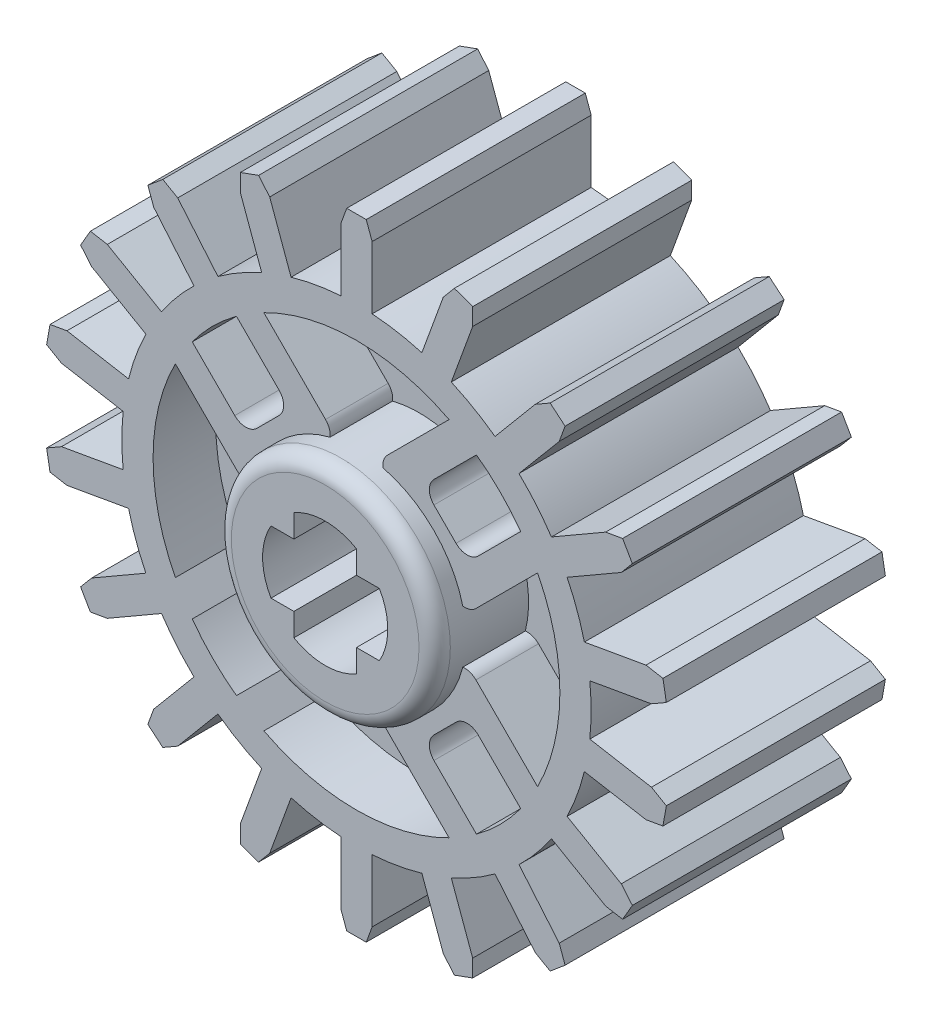
from build123d import *
from build123d.topology import SkipClean

# Parameters (mm, degrees)
SKETCH1_R                       = 7.5
SKETCH1_R_2                     = 2
BOSS_EXTRUDE1_DEPTH             = 3.5
SKETCH2_R                       = 6.5
CUT_EXTRUDE1_DEPTH              = 2
SKETCH5_R                       = 3.5
BOSS_EXTRUDE5_DEPTH             = 4.5
BOSS_EXTRUDE4_REACH             = 13.522
BOSS_EXTRUDE4_DIRECTION_2_REACH = 13.522
FILLET1_R                       = 0.5
CIRPATTERN1_START               = -3.5
CIRPATTERN1_DEPTH               = 7
BOSS_EXTRUDE6_DEPTH             = 7
CIRPATTERN2_COUNT               = 18
FILLET2_R                       = 0.5


with BuildPart() as part:
    # Sketch1 → Boss-Extrude1 (new, symmetric)
    # profile 1 of 5: a face of its own
    with BuildSketch(Plane.XY):
        Circle(SKETCH1_R)
        Circle(SKETCH1_R_2, mode=Mode.SUBTRACT)
    # profile 2 of 5: a face of its own
    with BuildSketch(Plane.XY):
        with BuildLine():
            Line((1, -1), (1, -1.732050808))
            ThreePointArc((1, -1.732050808), (1.414213562, -1.414213562), (1.732050808, -1))
            Line((1.732050808, -1), (1, -1))
        make_face()
    # profile 3 of 5: a face of its own
    with BuildSketch(Plane.XY):
        with BuildLine():
            ThreePointArc((-1.732050808, -1), (-1.414213562, -1.414213562), (-1, -1.732050808))
            Line((-1, -1.732050808), (-1, -1))
            Line((-1, -1), (-1.732050808, -1))
        make_face()
    # profile 4 of 5: a face of its own
    with BuildSketch(Plane.XY):
        with BuildLine():
            Line((-1.732050808, 1), (-1, 1))
            Line((-1, 1), (-1, 1.732050808))
            ThreePointArc((-1, 1.732050808), (-1.414213562, 1.414213562), (-1.732050808, 1))
        make_face()
    # profile 5 of 5: a face of its own
    with BuildSketch(Plane.XY):
        with BuildLine():
            Line((1, 1.732050808), (1, 1))
            Line((1, 1), (1.732050808, 1))
            ThreePointArc((1.732050808, 1), (1.414213562, 1.414213562), (1, 1.732050808))
        make_face()
    extrude(amount=BOSS_EXTRUDE1_DEPTH, both=True)

    # Sketch2 → Cut-Extrude1 (cut)
    with BuildSketch(Plane.XY.offset(3.5)):
        Circle(SKETCH2_R)
    cut_extrude1 = extrude(amount=-CUT_EXTRUDE1_DEPTH, mode=Mode.SUBTRACT)

    # Mirror1: Cut-Extrude1 across plane
    add(cut_extrude1.mirror(Plane.XY), mode=Mode.SUBTRACT)

    # Sketch5 → Boss-Extrude5 (add, symmetric)
    with SkipClean():  # the faces are left unmerged after this step: merging them gives an invalid solid
        with BuildSketch(Plane.XY):
            with Locations(Location((0, 0, 0), (0, 0, 180))):
                Circle(SKETCH5_R)
            with BuildLine():
                Line((-1.732050808, -1), (-1, -1))
                Line((-1, -1), (-1, -1.732050808))
                ThreePointArc((-1, -1.732050808), (0, -2), (1, -1.732050808))
                Line((1, -1.732050808), (1, -1))
                Line((1, -1), (1.732050808, -1))
                ThreePointArc((1.732050808, -1), (2, 0), (1.732050808, 1))
                Line((1.732050808, 1), (1, 1))
                Line((1, 1), (1, 1.732050808))
                ThreePointArc((1, 1.732050808), (0, 2), (-1, 1.732050808))
                Line((-1, 1.732050808), (-1, 1))
                Line((-1, 1), (-1.732050808, 1))
                ThreePointArc((-1.732050808, 1), (-2, 0), (-1.732050808, -1))
            make_face(mode=Mode.SUBTRACT)
        extrude(amount=BOSS_EXTRUDE5_DEPTH, both=True)

    # Boss-Extrude4: up to this face of the body (flat: up to its plane)
    boss_extrude4_end = Plane(part.part.faces().sort_by_distance((-7.287867966, 0, 3.5))[0])
    # Sketch3 → Boss-Extrude4 (add, up to the picked face)
    with BuildSketch(Plane.XY, mode=Mode.PRIVATE) as boss_extrude4_sk1:
        with BuildLine():
            ThreePointArc((3.83436875, 5.248582312), (3.407353004, 5.535336079), (2.959000359, 5.787427484))
            Line((2.959000359, 5.787427484), (0.707106781, 3.535533906))
            Line((0.707106781, 3.535533906), (3.535533906, 0.707106781))
            Line((3.535533906, 0.707106781), (5.787427484, 2.959000359))
            ThreePointArc((5.787427484, 2.959000359), (5.535336079, 3.407353004), (5.248582312, 3.83436875))
            Line((5.248582312, 3.83436875), (4.531371416, 3.117157854))
            Line((4.531371416, 3.117157854), (3.535533906, 2.121320344))
            Line((3.535533906, 2.121320344), (2.121320344, 3.535533906))
            Line((2.121320344, 3.535533906), (3.117157854, 4.531371416))
            Line((3.117157854, 4.531371416), (3.83436875, 5.248582312))
        make_face()
    boss_extrude4_tool1 = split(extrude(boss_extrude4_sk1.sketch, amount=BOSS_EXTRUDE4_REACH, mode=Mode.PRIVATE), bisect_by=boss_extrude4_end, keep=Keep.BOTH, mode=Mode.PRIVATE)
    add(boss_extrude4_tool1.solids().sort_by(Axis((1.883857, 4.610677, 0), (0, 0, 1)))[0])

    # Boss-Extrude4 direction 2: up to this face of the body (flat: up to its plane)
    boss_extrude4_direction_2_end = Plane(part.part.faces().sort_by_distance((-7.287867966, 0, -3.5))[0])
    # Sketch3 → Boss-Extrude4 direction 2 (add, up to the picked face)
    with BuildSketch(Plane.XY, mode=Mode.PRIVATE) as boss_extrude4_direction_2_sk1:
        with BuildLine():
            ThreePointArc((3.83436875, 5.248582312), (3.407353004, 5.535336079), (2.959000359, 5.787427484))
            Line((2.959000359, 5.787427484), (0.707106781, 3.535533906))
            Line((0.707106781, 3.535533906), (3.535533906, 0.707106781))
            Line((3.535533906, 0.707106781), (5.787427484, 2.959000359))
            ThreePointArc((5.787427484, 2.959000359), (5.535336079, 3.407353004), (5.248582312, 3.83436875))
            Line((5.248582312, 3.83436875), (4.531371416, 3.117157854))
            Line((4.531371416, 3.117157854), (3.535533906, 2.121320344))
            Line((3.535533906, 2.121320344), (2.121320344, 3.535533906))
            Line((2.121320344, 3.535533906), (3.117157854, 4.531371416))
            Line((3.117157854, 4.531371416), (3.83436875, 5.248582312))
        make_face()
    boss_extrude4_direction_2_tool1 = split(extrude(boss_extrude4_direction_2_sk1.sketch, amount=-BOSS_EXTRUDE4_DIRECTION_2_REACH, mode=Mode.PRIVATE), bisect_by=boss_extrude4_direction_2_end, keep=Keep.BOTH, mode=Mode.PRIVATE)
    add(boss_extrude4_direction_2_tool1.solids().sort_by(Axis((1.883857, 4.610677, 0), (0, 0, -1)))[0])

    # Fillet1
    # the kernel refuses this fillet: 0.5 mm, written as the material it adds along each edge
    with BuildSketch(Plane(origin=(2.121320344, 3.535533906, 0.25), x_dir=(0.7071067811865485, 0.7071067811865467, 0), z_dir=(0, 0, 1)), Plane(origin=(3.535533906, 2.121320344, 0.25), x_dir=(-0.7071067811865476, 0.7071067811865476, 0), z_dir=(0, 0, 1)), Plane(origin=(3.535533906, 2.121320344, -0.25), x_dir=(0.7071067811865471, 0.707106781186548, 0), z_dir=(0, 0, -1)), Plane(origin=(2.121320344, 3.535533906, -0.25), x_dir=(0.7071067811865476, -0.7071067811865476, 0), z_dir=(0, 0, -1))) as fillet1_piece_1:
        with BuildLine():
            CenterArc((FILLET1_R, -FILLET1_R), FILLET1_R, 90, 90)
            Line((0, -FILLET1_R), (0, 0))
            Line((0, 0), (FILLET1_R, 0))
        make_face()
    extrude(amount=3.25)
    # the kernel refuses this fillet: 0.5 mm, written as the material it takes off along each edge
    with BuildSketch(Plane(origin=(0.707106781, 3.535533906, 1.5), x_dir=(0.7071067812115436, -0.7071067811615515, 0), z_dir=(0, 0, 1))) as fillet1_2_piece_1:
        with BuildLine():
            CenterArc((0.5, 0.397903145), FILLET1_R, 179.999999998, 52.731478319)
            Line((0, 0.397903146), (0, 0))
            Line((0, 0), (0.197224362, 0))
        make_face()
    extrude(amount=2.994757864, mode=Mode.SUBTRACT)
    with BuildSketch(Plane(origin=(3.535533906, 0.707106781, 1.5), x_dir=(0.7071067811865472, 0.7071067811865478, 0), z_dir=(0, 0, 1)), Plane(origin=(0.707106781, 3.535533906, -1.5), x_dir=(0.7071067811865481, 0.707106781186547, 0), z_dir=(0, 0, -1))) as fillet1_2_piece_2:
        with BuildLine():
            CenterArc((0.397903146, 0.5), FILLET1_R, 217.268521681, 52.731478319)
            Line((0, 0.197224362), (0, 0))
            Line((0, 0), (0.397903146, 0))
        make_face()
    extrude(amount=2.994757864, mode=Mode.SUBTRACT)
    with BuildSketch(Plane(origin=(3.535533906, 0.707106781, -1.5), x_dir=(0.7071067811865472, 0.7071067811865478, 0), z_dir=(0, 0, -1))) as fillet1_2_piece_3:
        with BuildLine():
            CenterArc((0.397903146, -0.5), FILLET1_R, 90, 52.731478319)
            Line((0, -0.197224362), (0, 0))
            Line((0, 0), (0.397903146, 0))
        make_face()
    extrude(amount=2.994757864, mode=Mode.SUBTRACT)

    # CirPattern1: read off the stored shape, not the designer's step
    # CirPattern1 outline → CirPattern1 (add)
    with BuildSketch(Plane.XY.offset(CIRPATTERN1_START)):
        with BuildLine():
            Line((-3.816893918, -0.988466794), (-5.787427484, -2.959000359))
            ThreePointArc((-5.787427484, -2.959000359), (-5.535336079, -3.407353004), (-5.248582313, -3.83436875))
            Line((-5.248582313, -3.83436875), (-3.889087297, -2.474873734))
            ThreePointArc((-3.889087297, -2.474873734), (-3.535533906, -2.328427125), (-3.181980515, -2.474873734))
            Line((-3.181980515, -2.474873734), (-2.474873734, -3.181980515))
            ThreePointArc((-2.474873734, -3.181980515), (-2.328427125, -3.535533906), (-2.474873734, -3.889087297))
            Line((-2.474873734, -3.889087297), (-3.83436875, -5.248582313))
            ThreePointArc((-3.83436875, -5.248582313), (-3.407353004, -5.535336079), (-2.959000359, -5.787427484))
            Line((-2.959000359, -5.787427484), (-0.988466794, -3.816893918))
            ThreePointArc((-0.988466794, -3.816893918), (-0.868231427, -3.62310352), (-0.846565465, -3.396075222))
            ThreePointArc((-0.846565465, -3.396075222), (-2.474873734, -2.474873734), (-3.396075222, -0.846565465))
            ThreePointArc((-3.396075222, -0.846565465), (-3.62310352, -0.868231427), (-3.816893918, -0.988466794))
        make_face()
        with BuildLine():
            ThreePointArc((-5.248582313, 3.83436875), (-5.535336079, 3.407353004), (-5.787427484, 2.959000359))
            Line((-5.787427484, 2.959000359), (-3.816893918, 0.988466794))
            ThreePointArc((-3.816893918, 0.988466794), (-3.62310352, 0.868231427), (-3.396075222, 0.846565465))
            ThreePointArc((-3.396075222, 0.846565465), (-2.474873734, 2.474873734), (-0.846565465, 3.396075222))
            ThreePointArc((-0.846565465, 3.396075222), (-0.868231427, 3.62310352), (-0.988466794, 3.816893918))
            Line((-0.988466794, 3.816893918), (-2.959000359, 5.787427484))
            ThreePointArc((-2.959000359, 5.787427484), (-3.407353004, 5.535336079), (-3.83436875, 5.248582313))
            Line((-3.83436875, 5.248582313), (-2.474873734, 3.889087297))
            ThreePointArc((-2.474873734, 3.889087297), (-2.328427125, 3.535533906), (-2.474873734, 3.181980515))
            Line((-2.474873734, 3.181980515), (-3.181980515, 2.474873734))
            ThreePointArc((-3.181980515, 2.474873734), (-3.535533906, 2.328427125), (-3.889087297, 2.474873734))
            Line((-3.889087297, 2.474873734), (-5.248582313, 3.83436875))
        make_face()
        with BuildLine():
            ThreePointArc((3.396075222, -0.846565465), (2.474873734, -2.474873734), (0.846565465, -3.396075222))
            ThreePointArc((0.846565465, -3.396075222), (0.868231427, -3.62310352), (0.988466794, -3.816893918))
            Line((0.988466794, -3.816893918), (2.959000359, -5.787427484))
            ThreePointArc((2.959000359, -5.787427484), (3.407353004, -5.535336079), (3.83436875, -5.248582313))
            Line((3.83436875, -5.248582313), (2.474873734, -3.889087297))
            ThreePointArc((2.474873734, -3.889087297), (2.328427125, -3.535533906), (2.474873734, -3.181980515))
            Line((2.474873734, -3.181980515), (3.181980515, -2.474873734))
            ThreePointArc((3.181980515, -2.474873734), (3.535533906, -2.328427125), (3.889087297, -2.474873734))
            Line((3.889087297, -2.474873734), (5.248582313, -3.83436875))
            ThreePointArc((5.248582313, -3.83436875), (5.535336079, -3.407353004), (5.787427484, -2.959000359))
            Line((5.787427484, -2.959000359), (3.816893918, -0.988466794))
            ThreePointArc((3.816893918, -0.988466794), (3.62310352, -0.868231427), (3.396075222, -0.846565465))
        make_face()
    extrude(amount=CIRPATTERN1_DEPTH)

    # Sketch6 → Boss-Extrude6 (add)
    with BuildSketch(Plane.XY.offset(3.5)):
        with BuildLine():
            Line((-0.5, 7.483314774), (-0.5, 9.483314774))
            Line((-0.5, 9.483314774), (-0.311941957, 10))
            Line((-0.311941957, 10), (0.311941957, 10))
            Line((0.311941957, 10), (0.5, 9.483314774))
            Line((0.5, 9.483314774), (0.5, 7.483314774))
            ThreePointArc((0.5, 7.483314774), (0, 7.5), (-0.5, 7.483314774))
        make_face()
    boss_extrude6 = extrude(amount=-BOSS_EXTRUDE6_DEPTH)

    # CirPattern2: Boss-Extrude6 ×18 about axis
    cirpattern2_axis = Axis((0, 0, 0), (0, 0, 1))
    for i in range(1, CIRPATTERN2_COUNT):
        add(boss_extrude6.rotate(cirpattern2_axis, i * 360 / CIRPATTERN2_COUNT))

    # Fillet2
    # the kernel refuses this fillet: 0.5 mm, written as the material it takes off along each edge
    with BuildSketch(Plane(origin=(0, 0, 4.5), x_dir=(-1, 0, 0), z_dir=(0, 1, 0))) as fillet2_piece_1:
        with BuildLine():
            CenterArc((3.5 - FILLET2_R, -FILLET2_R), FILLET2_R, 0, 90)
            Line((3.5 - FILLET2_R, 0), (3.5, 0))
            Line((3.5, 0), (3.5, -FILLET2_R))
        make_face()
    revolve(axis=Axis((0, 0, 4.5), (0, 0, 1)), mode=Mode.SUBTRACT)
    with BuildSketch(Plane(origin=(0, 0, -4.5), x_dir=(-1, 0, 0), z_dir=(0, 1, 0))) as fillet2_piece_2:
        with BuildLine():
            CenterArc((3.5 - FILLET2_R, FILLET2_R), FILLET2_R, 270, 90)
            Line((3.5 - FILLET2_R, 0), (3.5, 0))
            Line((3.5, 0), (3.5, FILLET2_R))
        make_face()
    revolve(axis=Axis((0, 0, -4.5), (0, 0, 1)), mode=Mode.SUBTRACT)


solid = part.part
